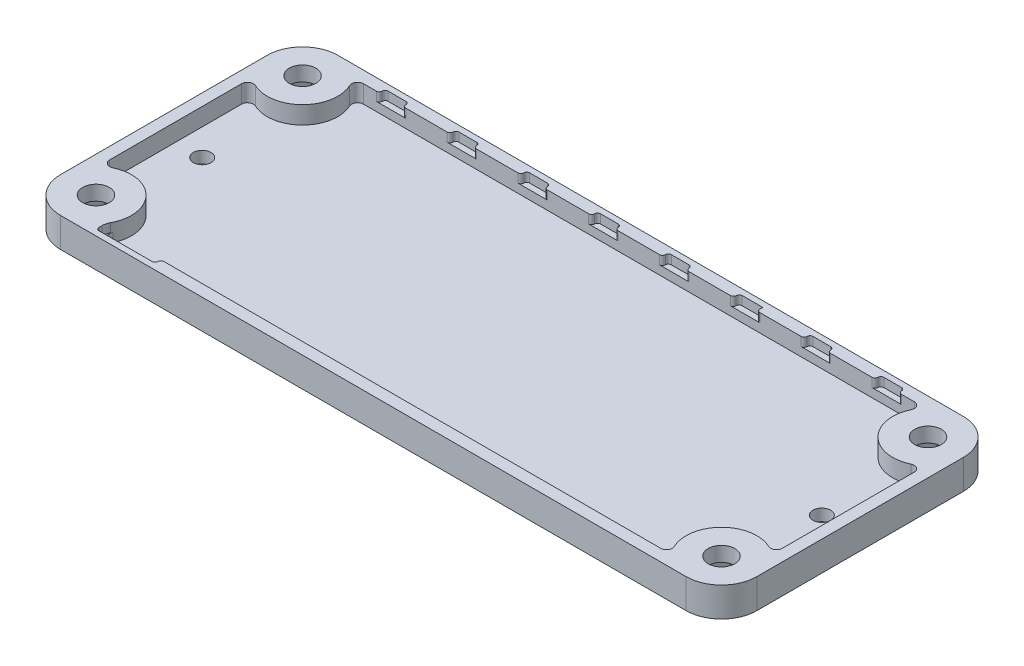
from build123d import *

# Parameters (mm, degrees)
SKETCH1_W           = 118
SKETCH1_H           = 47
BOSS_EXTRUDE1_DEPTH = 5
FILLET1_R           = 6
SKETCH4_R           = 2.25
CUT_EXTRUDE1_DEPTH  = 64.704395453
CUT_EXTRUDE2_DEPTH  = 2.5
CUT_EXTRUDE3_DEPTH  = 3
FILLET2_R           = 1
SKETCH7_W           = 4
SKETCH7_H           = 1
CUT_EXTRUDE4_DEPTH  = 1.5
FILLET3_START       = 3.5
FILLET3_DEPTH       = 2.5
FILLET3_2_DEPTH     = 1.5
SKETCH8_R           = 1.5
CUT_EXTRUDE5_DEPTH  = 64.578691399


with BuildPart() as part:
    # Sketch1 → Boss-Extrude1 (new body)
    with BuildSketch(Plane(origin=(0, 0, 0), x_dir=(1, 0, 0), z_dir=(0, 1, 0))):
        Rectangle(SKETCH1_W, SKETCH1_H)
    extrude(amount=BOSS_EXTRUDE1_DEPTH)

    # Fillet1
    fillet1_edges = [part.edges().sort_by_distance(p)[0] for p in [
        (59, 2.5, 23.5),
        (-59, 2.5, 23.5),
        (-59, 2.5, -23.5),
        (59, 2.5, -23.5),
    ]]
    fillet(fillet1_edges, radius=FILLET1_R)

    # Sketch4 → Cut-Extrude1 (cut, through all)
    with BuildSketch(Plane(origin=(0, 5, 0), x_dir=(1, 0, 0), z_dir=(0, 1, 0))):
        with Locations(Location((53, -17.5, 0), (0, 0, 270))):
            Circle(SKETCH4_R)
        with Locations(Location((-53, -17.5, 0), (0, 0, 90))):
            Circle(SKETCH4_R)
        with Locations(Location((53, 17.5, 0), (0, 0, 90))):
            Circle(SKETCH4_R)
        with Locations(Location((-53, 17.5, 0), (0, 0, 270))):
            Circle(SKETCH4_R)
    extrude(amount=-CUT_EXTRUDE1_DEPTH, mode=Mode.SUBTRACT)

    # Sketch5 → Cut-Extrude2 (cut)
    with BuildSketch(Plane.XZ):
        Polygon((50.907105274, -13.875), (48.814210548, -17.5), (50.907105274, -21.125), (55.092894726, -21.125), (57.185789452, -17.5), (55.092894726, -13.875), align=None)
        Polygon((57.185789452, 17.5), (55.092894726, 13.875), (50.907105274, 13.875), (48.814210548, 17.5), (50.907105274, 21.125), (55.092894726, 21.125), align=None)
        Polygon((-57.185789452, -17.5), (-55.092894726, -13.875), (-50.907105274, -13.875), (-48.814210548, -17.5), (-50.907105274, -21.125), (-55.092894726, -21.125), align=None)
        Polygon((-55.092894726, 13.875), (-50.907105274, 13.875), (-48.814210548, 17.5), (-50.907105274, 21.125), (-55.092894726, 21.125), (-57.185789452, 17.5), align=None)
    extrude(amount=-CUT_EXTRUDE2_DEPTH, mode=Mode.SUBTRACT)

    # Sketch6 → Cut-Extrude3 (cut)
    with BuildSketch(Plane(origin=(0, 5, 0), x_dir=(1, 0, 0), z_dir=(0, 1, 0))):
        with BuildLine():
            Line((57, 13.027864045), (57, -13.027864045))
            ThreePointArc((57, -13.027864045), (48.757359313, -13.257359313), (48.527864045, -21.5))
            Line((48.527864045, -21.5), (-48.527864045, -21.5))
            ThreePointArc((-48.527864045, -21.5), (-48.757359313, -13.257359313), (-57, -13.027864045))
            Line((-57, -13.027864045), (-57, 13.027864045))
            ThreePointArc((-57, 13.027864045), (-48.757359313, 13.257359313), (-48.527864045, 21.5))
            Line((-48.527864045, 21.5), (48.527864045, 21.5))
            ThreePointArc((48.527864045, 21.5), (48.757359313, 13.257359313), (57, 13.027864045))
        make_face()
    extrude(amount=-CUT_EXTRUDE3_DEPTH, mode=Mode.SUBTRACT)

    # Fillet2
    fillet2_edges = [part.edges().sort_by_distance(p)[0] for p in [
        (48.527864045, 3.5, -21.5),
        (57, 3.5, -13.027864045),
        (57, 3.5, 13.027864045),
        (48.527864045, 3.5, 21.5),
        (-48.527864045, 3.5, 21.5),
        (-57, 3.5, 13.027864045),
        (-57, 3.5, -13.027864045),
        (-48.527864045, 3.5, -21.5),
    ]]
    fillet(fillet2_edges, radius=FILLET2_R)

    # Sketch7 → Cut-Extrude4 (cut)
    with BuildSketch(Plane(origin=(0, 5, 0), x_dir=(1, 0, 0), z_dir=(0, 1, 0))):
        with BuildLine():
            Line((-48, -21.5), (-48, -22.5))
            Line((-48, -22.5), (-38, -22.5))
            Line((-38, -22.5), (-38, -21.5))
            Line((-38, -21.5), (-46.67544468, -21.5))
            ThreePointArc((-46.67544468, -21.5), (-47.520598934, -21.034522484), (-47.578952583, -20.071428571))
            ThreePointArc((-47.578952583, -20.071428571), (-47.640934848, -20.198225473), (-47.705882353, -20.323529412))
            ThreePointArc((-47.705882353, -20.323529412), (-47.92535625, -20.893660937), (-48, -21.5))
        make_face()
        with Locations((-42, 22)):
            Rectangle(SKETCH7_W, SKETCH7_H)
        with Locations((-30, 22)):
            Rectangle(SKETCH7_W, SKETCH7_H)
        with Locations((-18, 22)):
            Rectangle(SKETCH7_W, SKETCH7_H)
        with Locations((-6, 22)):
            Rectangle(SKETCH7_W, SKETCH7_H)
        with Locations((6, 22)):
            Rectangle(SKETCH7_W, SKETCH7_H)
        with Locations((18, 22)):
            Rectangle(SKETCH7_W, SKETCH7_H)
        with Locations((30, 22)):
            Rectangle(SKETCH7_W, SKETCH7_H)
        with Locations((42, 22)):
            Rectangle(SKETCH7_W, SKETCH7_H)
    extrude(amount=-CUT_EXTRUDE4_DEPTH, mode=Mode.SUBTRACT)

    # Fillet3: read off the stored shape, not the designer's step
    # Fillet3 outline → Fillet3 (cut)
    with BuildSketch(Plane(origin=(0, 0, 0), x_dir=(1, 0, 0), z_dir=(0, 1, 0)).offset(FILLET3_START)):
        with BuildLine():
            Line((-40, 21.5), (-39.5, 21.5))
            ThreePointArc((-39.5, 21.5), (-39.853553391, 21.646446609), (-40, 22))
            Line((-40, 22), (-40, 21.5))
        make_face()
        with BuildLine():
            Line((-28, 21.5), (-27.5, 21.5))
            ThreePointArc((-27.5, 21.5), (-27.853553391, 21.646446609), (-28, 22))
            Line((-28, 22), (-28, 21.5))
        make_face()
        with BuildLine():
            Line((-16, 21.5), (-15.5, 21.5))
            ThreePointArc((-15.5, 21.5), (-15.853553391, 21.646446609), (-16, 22))
            Line((-16, 22), (-16, 21.5))
        make_face()
        with BuildLine():
            Line((-4, 21.5), (-3.5, 21.5))
            ThreePointArc((-3.5, 21.5), (-3.853553391, 21.646446609), (-4, 22))
            Line((-4, 22), (-4, 21.5))
        make_face()
        with BuildLine():
            Line((8, 21.5), (8.5, 21.5))
            ThreePointArc((8.5, 21.5), (8.146446609, 21.646446609), (8, 22))
            Line((8, 22), (8, 21.5))
        make_face()
        with BuildLine():
            Line((20, 21.5), (20.5, 21.5))
            ThreePointArc((20.5, 21.5), (20.146446609, 21.646446609), (20, 22))
            Line((20, 22), (20, 21.5))
        make_face()
        with BuildLine():
            Line((32, 21.5), (32.5, 21.5))
            ThreePointArc((32.5, 21.5), (32.146446609, 21.646446609), (32, 22))
            Line((32, 22), (32, 21.5))
        make_face()
        with BuildLine():
            ThreePointArc((44.5, 21.5), (44.146446609, 21.646446609), (44, 22))
            Line((44, 22), (44, 21.5))
            Line((44, 21.5), (44.5, 21.5))
        make_face()
        with BuildLine():
            Line((39.5, 21.5), (40, 21.5))
            Line((40, 21.5), (40, 22))
            ThreePointArc((40, 22), (39.853553391, 21.646446609), (39.5, 21.5))
        make_face()
        with BuildLine():
            Line((27.5, 21.5), (28, 21.5))
            Line((28, 21.5), (28, 22))
            ThreePointArc((28, 22), (27.853553391, 21.646446609), (27.5, 21.5))
        make_face()
        with BuildLine():
            Line((15.5, 21.5), (16, 21.5))
            Line((16, 21.5), (16, 22))
            ThreePointArc((16, 22), (15.853553391, 21.646446609), (15.5, 21.5))
        make_face()
        with BuildLine():
            Line((3.5, 21.5), (4, 21.5))
            Line((4, 21.5), (4, 22))
            ThreePointArc((4, 22), (3.853553391, 21.646446609), (3.5, 21.5))
        make_face()
        with BuildLine():
            Line((-8.5, 21.5), (-8, 21.5))
            Line((-8, 21.5), (-8, 22))
            ThreePointArc((-8, 22), (-8.146446609, 21.646446609), (-8.5, 21.5))
        make_face()
        with BuildLine():
            Line((-20.5, 21.5), (-20, 21.5))
            Line((-20, 21.5), (-20, 22))
            ThreePointArc((-20, 22), (-20.146446609, 21.646446609), (-20.5, 21.5))
        make_face()
        with BuildLine():
            Line((-32.5, 21.5), (-32, 21.5))
            Line((-32, 21.5), (-32, 22))
            ThreePointArc((-32, 22), (-32.146446609, 21.646446609), (-32.5, 21.5))
        make_face()
        with BuildLine():
            Line((-44.5, 21.5), (-44, 21.5))
            Line((-44, 21.5), (-44, 22))
            ThreePointArc((-44, 22), (-44.146446609, 21.646446609), (-44.5, 21.5))
        make_face()
        with BuildLine():
            Line((-38, -21.5), (-38, -22))
            ThreePointArc((-38, -22), (-37.853553391, -21.646446609), (-37.5, -21.5))
            Line((-37.5, -21.5), (-38, -21.5))
        make_face()
    extrude(amount=FILLET3_DEPTH, mode=Mode.SUBTRACT)

    # Fillet3 2 outline → Fillet3 2 (add)
    with BuildSketch(Plane(origin=(0, 0, 0), x_dir=(1, 0, 0), z_dir=(0, 1, 0)).offset(FILLET3_START)):
        with BuildLine():
            ThreePointArc((43.5, 22.5), (43.853553391, 22.353553391), (44, 22))
            Line((44, 22), (44, 22.5))
            Line((44, 22.5), (43.5, 22.5))
        make_face()
        with BuildLine():
            ThreePointArc((40, 22), (40.146446609, 22.353553391), (40.5, 22.5))
            Line((40.5, 22.5), (40, 22.5))
            Line((40, 22.5), (40, 22))
        make_face()
        with BuildLine():
            ThreePointArc((31.5, 22.5), (31.853553391, 22.353553391), (32, 22))
            Line((32, 22), (32, 22.5))
            Line((32, 22.5), (31.5, 22.5))
        make_face()
        with BuildLine():
            ThreePointArc((28, 22), (28.146446609, 22.353553391), (28.5, 22.5))
            Line((28.5, 22.5), (28, 22.5))
            Line((28, 22.5), (28, 22))
        make_face()
        with BuildLine():
            ThreePointArc((16, 22), (16.146446609, 22.353553391), (16.5, 22.5))
            Line((16.5, 22.5), (16, 22.5))
            Line((16, 22.5), (16, 22))
        make_face()
        with BuildLine():
            ThreePointArc((7.5, 22.5), (7.853553391, 22.353553391), (8, 22))
            Line((8, 22), (8, 22.5))
            Line((8, 22.5), (7.5, 22.5))
        make_face()
        with BuildLine():
            ThreePointArc((4, 22), (4.146446609, 22.353553391), (4.5, 22.5))
            Line((4.5, 22.5), (4, 22.5))
            Line((4, 22.5), (4, 22))
        make_face()
        with BuildLine():
            ThreePointArc((-4.5, 22.5), (-4.146446609, 22.353553391), (-4, 22))
            Line((-4, 22), (-4, 22.5))
            Line((-4, 22.5), (-4.5, 22.5))
        make_face()
        with BuildLine():
            ThreePointArc((-8, 22), (-7.853553391, 22.353553391), (-7.5, 22.5))
            Line((-7.5, 22.5), (-8, 22.5))
            Line((-8, 22.5), (-8, 22))
        make_face()
        with BuildLine():
            ThreePointArc((-16.5, 22.5), (-16.146446609, 22.353553391), (-16, 22))
            Line((-16, 22), (-16, 22.5))
            Line((-16, 22.5), (-16.5, 22.5))
        make_face()
        with BuildLine():
            ThreePointArc((-20, 22), (-19.853553391, 22.353553391), (-19.5, 22.5))
            Line((-19.5, 22.5), (-20, 22.5))
            Line((-20, 22.5), (-20, 22))
        make_face()
        with BuildLine():
            ThreePointArc((-28.5, 22.5), (-28.146446609, 22.353553391), (-28, 22))
            Line((-28, 22), (-28, 22.5))
            Line((-28, 22.5), (-28.5, 22.5))
        make_face()
        with BuildLine():
            ThreePointArc((-32, 22), (-31.853553391, 22.353553391), (-31.5, 22.5))
            Line((-31.5, 22.5), (-32, 22.5))
            Line((-32, 22.5), (-32, 22))
        make_face()
        with BuildLine():
            ThreePointArc((-40.5, 22.5), (-40.146446609, 22.353553391), (-40, 22))
            Line((-40, 22), (-40, 22.5))
            Line((-40, 22.5), (-40.5, 22.5))
        make_face()
        with BuildLine():
            ThreePointArc((-44, 22), (-43.853553391, 22.353553391), (-43.5, 22.5))
            Line((-43.5, 22.5), (-44, 22.5))
            Line((-44, 22.5), (-44, 22))
        make_face()
        with BuildLine():
            Line((-48, -22.5), (-47.5, -22.5))
            ThreePointArc((-47.5, -22.5), (-47.853553391, -22.353553391), (-48, -22))
            Line((-48, -22), (-48, -22.5))
        make_face()
        with BuildLine():
            ThreePointArc((-38, -22), (-38.146446609, -22.353553391), (-38.5, -22.5))
            Line((-38.5, -22.5), (-38, -22.5))
            Line((-38, -22.5), (-38, -22))
        make_face()
    extrude(amount=FILLET3_2_DEPTH)

    # Sketch8 → Cut-Extrude5 (cut, through all)
    with BuildSketch(Plane(origin=(0, 2, 0), x_dir=(1, 0, 0), z_dir=(0, 1, 0))):
        with Locations(Location((-52.5, 0, 0), (0, 0, 270))):
            Circle(SKETCH8_R)
        with Locations(Location((52.5, 0, 0), (0, 0, 90))):
            Circle(SKETCH8_R)
    extrude(amount=-CUT_EXTRUDE5_DEPTH, mode=Mode.SUBTRACT)


solid = part.part
